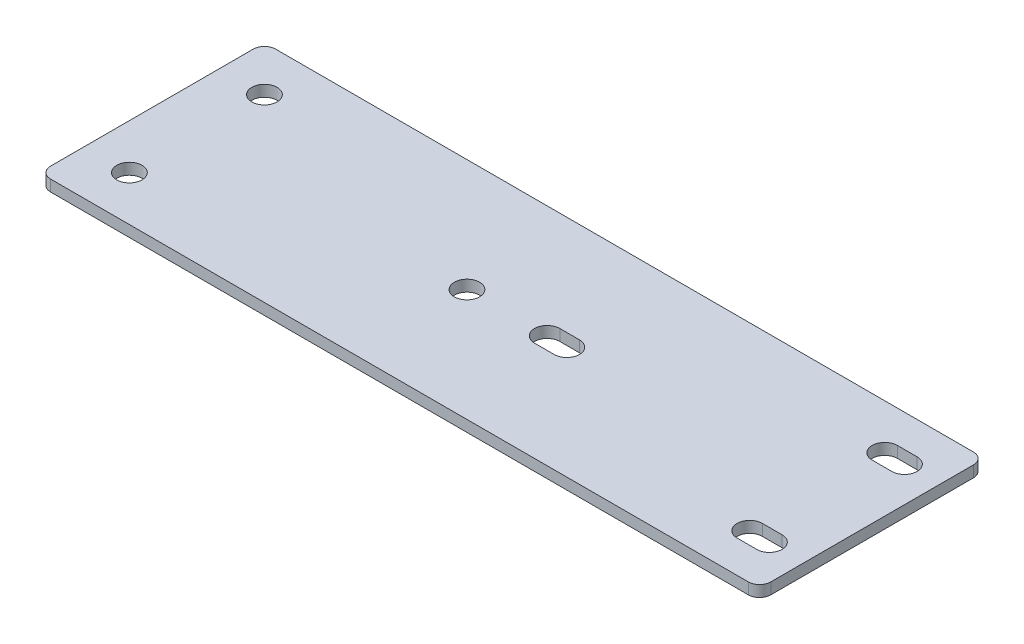
from build123d import *

# Parameters (mm, degrees)
SKETCH1_W                           = 203.2
SKETCH1_H                           = 63.5
BOSS_EXTRUDE1_DEPTH                 = 3.175
F_9_32_0_28125_DIAMETER_HOLE1_D     = 7.14375
F_9_32_0_28125_DIAMETER_SLOT1_DEPTH = 3.175
FILLET1_R                           = 3.175


# Read off the part's stored shape, not the designer's step: 9/32 (0.28125) Diameter Slot1
with BuildPart() as part:
    # Sketch1 → Boss-Extrude1 (new body)
    with BuildSketch(Plane(origin=(0, 0, 0), x_dir=(1, 0, 0), z_dir=(0, 1, 0))):
        with Locations((101.6, 31.75)):
            Rectangle(SKETCH1_W, SKETCH1_H)
    extrude(amount=BOSS_EXTRUDE1_DEPTH)

    # 9/32 (0.28125) Diameter Hole1 (through all)
    with Locations(Plane(origin=(0, 3.175, 0), x_dir=(1, 0, 0), z_dir=(0, 1, 0))):
        with Locations((12.7, 12.7), (12.7, 50.8), (88.9, 31.75)):
            Hole(F_9_32_0_28125_DIAMETER_HOLE1_D / 2)

    # 9/32 (0.28125) Diameter Slot1 outline → 9/32 (0.28125) Diameter Slot1 (cut)
    with BuildSketch(Plane(origin=(0, 0, 0), x_dir=(1, 0, 0), z_dir=(0, 1, 0))):
        with BuildLine():
            Line((187.721875, 9.128125), (193.278125, 9.128125))
            ThreePointArc((193.278125, 9.128125), (196.85, 12.7), (193.278125, 16.271875))
            Line((193.278125, 16.271875), (187.721875, 16.271875))
            ThreePointArc((187.721875, 16.271875), (184.15, 12.7), (187.721875, 9.128125))
        make_face()
        with BuildLine():
            Line((187.721875, 47.228125), (193.278125, 47.228125))
            ThreePointArc((193.278125, 47.228125), (196.85, 50.8), (193.278125, 54.371875))
            Line((193.278125, 54.371875), (187.721875, 54.371875))
            ThreePointArc((187.721875, 54.371875), (184.15, 50.8), (187.721875, 47.228125))
        make_face()
        with BuildLine():
            Line((111.521875, 28.178125), (117.078125, 28.178125))
            ThreePointArc((117.078125, 28.178125), (120.65, 31.75), (117.078125, 35.321875))
            Line((117.078125, 35.321875), (111.521875, 35.321875))
            ThreePointArc((111.521875, 35.321875), (107.95, 31.75), (111.521875, 28.178125))
        make_face()
    extrude(amount=F_9_32_0_28125_DIAMETER_SLOT1_DEPTH, mode=Mode.SUBTRACT)

    # Fillet1
    fillet1_edges = [part.edges().sort_by_distance(p)[0] for p in [
        (0, 1.5875, -63.5),
        (203.2, 1.5875, -63.5),
        (203.2, 1.5875, 0),
        (0, 1.5875, 0),
    ]]
    fillet(fillet1_edges, radius=FILLET1_R)


solid = part.part
